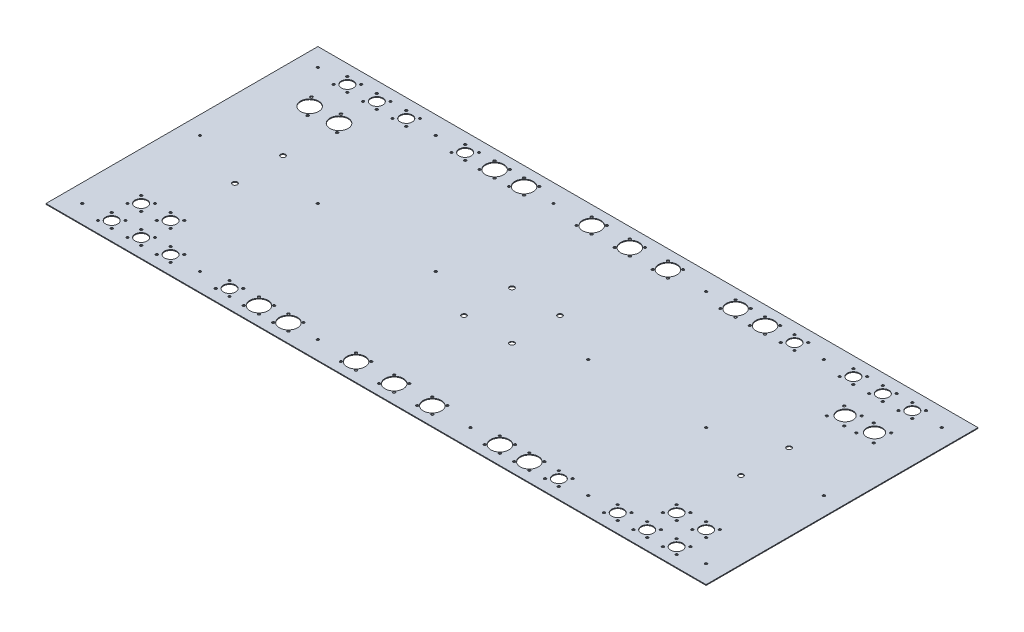
from build123d import *

# Parameters (mm, degrees)
MAIN_PLATE_W        = 874
MAIN_PLATE_H        = 360
BOSS_EXTRUDE1_DEPTH = 1.016
MAIN_HOLES_R        = 1.6
MAIN_HOLES_R_2      = 3.175
CUT_EXTRUDE1_DEPTH  = 473.620389167
FAN_R               = 1.6
FAN_R_2             = 12
CUT_EXTRUDE2_DEPTH  = 474.008271082
NTYPE_R             = 8
NTYPE_R_2           = 1.6
CUT_EXTRUDE3_DEPTH  = 473.620389167
ETHERNET_R          = 12
ETHERNET_R_2        = 1.755
CUT_EXTRUDE6_DEPTH  = 10
POWER_R             = 10.4521
POWER_R_2           = 1.5875
CUT_EXTRUDE7_DEPTH  = 10


with BuildPart() as part:
    # main_plate → Boss-Extrude1 (new body)
    with BuildSketch(Plane(origin=(0, 0, 0), x_dir=(1, 0, 0), z_dir=(0, 1, 0))):
        Rectangle(MAIN_PLATE_W, MAIN_PLATE_H)
    extrude(amount=BOSS_EXTRUDE1_DEPTH)

    # main_holes → Cut-Extrude1 (cut, through all)
    with BuildSketch(Plane(origin=(0, 1.016, 0), x_dir=(1, 0, 0), z_dir=(0, 1, 0))):
        with Locations((-413, 156)):
            Circle(MAIN_HOLES_R)
        with Locations((-335, 31.805896398)):
            Circle(MAIN_HOLES_R_2)
        with Locations((-335, -31.805896398)):
            Circle(MAIN_HOLES_R_2)
        with Locations((-257, 156)):
            Circle(MAIN_HOLES_R)
        with Locations((-101, 156)):
            Circle(MAIN_HOLES_R)
        with Locations((-257, 0)):
            Circle(MAIN_HOLES_R)
        with Locations((-101, 0)):
            Circle(MAIN_HOLES_R)
        with Locations((-257, -156)):
            Circle(MAIN_HOLES_R)
        with Locations((-101, -156)):
            Circle(MAIN_HOLES_R)
        with Locations((-413, 0)):
            Circle(MAIN_HOLES_R)
        with Locations((-413, -156)):
            Circle(MAIN_HOLES_R)
        with Locations((-31.75, 31.75)):
            Circle(MAIN_HOLES_R_2)
        with Locations((-31.75, -31.75)):
            Circle(MAIN_HOLES_R_2)
        with Locations((31.75, -31.75)):
            Circle(MAIN_HOLES_R_2)
        with Locations((31.75, 31.75)):
            Circle(MAIN_HOLES_R_2)
        with Locations((413, -156)):
            Circle(MAIN_HOLES_R)
        with Locations((413, 0)):
            Circle(MAIN_HOLES_R)
        with Locations((101, -156)):
            Circle(MAIN_HOLES_R)
        with Locations((257, -156)):
            Circle(MAIN_HOLES_R)
        with Locations((101, 0)):
            Circle(MAIN_HOLES_R)
        with Locations((257, 0)):
            Circle(MAIN_HOLES_R)
        with Locations((101, 156)):
            Circle(MAIN_HOLES_R)
        with Locations((257, 156)):
            Circle(MAIN_HOLES_R)
        with Locations((335, -31.805896398)):
            Circle(MAIN_HOLES_R_2)
        with Locations((335, 31.805896398)):
            Circle(MAIN_HOLES_R_2)
        with Locations((413, 156)):
            Circle(MAIN_HOLES_R)
    extrude(amount=-CUT_EXTRUDE1_DEPTH, mode=Mode.SUBTRACT)

    # fan → Cut-Extrude2 (cut, through all)
    with BuildSketch(Plane(origin=(0, 1.016, 1.016), x_dir=(1, 0, 0), z_dir=(0, 1, 0))):
        with Locations((130, -144.984)):
            Circle(FAN_R)
        with Locations((150, -144.984)):
            Circle(FAN_R)
        with Locations((150, -164.984)):
            Circle(FAN_R)
        with Locations((130, -164.984)):
            Circle(FAN_R)
        with Locations((140, -154.984)):
            Circle(FAN_R_2)
        with Locations((169, -144.984)):
            Circle(FAN_R)
        with Locations((189, -144.984)):
            Circle(FAN_R)
        with Locations((189, -164.984)):
            Circle(FAN_R)
        with Locations((169, -164.984)):
            Circle(FAN_R)
        with Locations((179, -154.984)):
            Circle(FAN_R_2)
        with Locations((-10, -144.984)):
            Circle(FAN_R)
        with Locations((10, -144.984)):
            Circle(FAN_R)
        with Locations((10, -164.984)):
            Circle(FAN_R)
        with Locations((-10, -164.984)):
            Circle(FAN_R)
        with Locations((0, -154.984)):
            Circle(FAN_R_2)
        with Locations((-60.5, -144.984)):
            Circle(FAN_R)
        with Locations((-40.5, -144.984)):
            Circle(FAN_R)
        with Locations((-40.5, -164.984)):
            Circle(FAN_R)
        with Locations((-60.5, -164.984)):
            Circle(FAN_R)
        with Locations((-50.5, -154.984)):
            Circle(FAN_R_2)
        with Locations((40.5, -144.984)):
            Circle(FAN_R)
        with Locations((60.5, -144.984)):
            Circle(FAN_R)
        with Locations((60.5, -164.984)):
            Circle(FAN_R)
        with Locations((40.5, -164.984)):
            Circle(FAN_R)
        with Locations((50.5, -154.984)):
            Circle(FAN_R_2)
        with Locations((-10, 167.016)):
            Circle(FAN_R)
        with Locations((10, 167.016)):
            Circle(FAN_R)
        with Locations((10, 147.016)):
            Circle(FAN_R)
        with Locations((-10, 147.016)):
            Circle(FAN_R)
        with Locations((0, 157.016)):
            Circle(FAN_R_2)
        with Locations((-60.5, 167.016)):
            Circle(FAN_R)
        with Locations((-40.5, 167.016)):
            Circle(FAN_R)
        with Locations((-40.5, 147.016)):
            Circle(FAN_R)
        with Locations((-60.5, 147.016)):
            Circle(FAN_R)
        with Locations((-50.5, 157.016)):
            Circle(FAN_R_2)
        with Locations((40.5, 167.016)):
            Circle(FAN_R)
        with Locations((60.5, 167.016)):
            Circle(FAN_R)
        with Locations((60.5, 147.016)):
            Circle(FAN_R)
        with Locations((40.5, 147.016)):
            Circle(FAN_R)
        with Locations((50.5, 157.016)):
            Circle(FAN_R_2)
        with Locations((-189, -144.984)):
            Circle(FAN_R)
        with Locations((-169, -144.984)):
            Circle(FAN_R)
        with Locations((-169, -164.984)):
            Circle(FAN_R)
        with Locations((-189, -164.984)):
            Circle(FAN_R)
        with Locations((-179, -154.984)):
            Circle(FAN_R_2)
        with Locations((-150, -144.984)):
            Circle(FAN_R)
        with Locations((-130, -144.984)):
            Circle(FAN_R)
        with Locations((-130, -164.984)):
            Circle(FAN_R)
        with Locations((-150, -164.984)):
            Circle(FAN_R)
        with Locations((-140, -154.984)):
            Circle(FAN_R_2)
        with Locations((-189, 167.016)):
            Circle(FAN_R)
        with Locations((-169, 167.016)):
            Circle(FAN_R)
        with Locations((-169, 147.016)):
            Circle(FAN_R)
        with Locations((-189, 147.016)):
            Circle(FAN_R)
        with Locations((-179, 157.016)):
            Circle(FAN_R_2)
        with Locations((-150, 167.016)):
            Circle(FAN_R)
        with Locations((-130, 167.016)):
            Circle(FAN_R)
        with Locations((-130, 147.016)):
            Circle(FAN_R)
        with Locations((-150, 147.016)):
            Circle(FAN_R)
        with Locations((-140, 157.016)):
            Circle(FAN_R_2)
        with Locations((130, 167.016)):
            Circle(FAN_R)
        with Locations((150, 167.016)):
            Circle(FAN_R)
        with Locations((150, 147.016)):
            Circle(FAN_R)
        with Locations((130, 147.016)):
            Circle(FAN_R)
        with Locations((140, 157.016)):
            Circle(FAN_R_2)
        with Locations((169, 167.016)):
            Circle(FAN_R)
        with Locations((189, 167.016)):
            Circle(FAN_R)
        with Locations((189, 147.016)):
            Circle(FAN_R)
        with Locations((169, 147.016)):
            Circle(FAN_R)
        with Locations((179, 157.016)):
            Circle(FAN_R_2)
    extrude(amount=-CUT_EXTRUDE2_DEPTH, mode=Mode.SUBTRACT)

    # ntype → Cut-Extrude3 (cut, through all)
    with BuildSketch(Plane(origin=(0, 1.016, 0), x_dir=(1, 0, 0), z_dir=(0, 1, 0))):
        with Locations((-218, 156)):
            Circle(NTYPE_R)
        with Locations((-227.1, 165.1)):
            Circle(NTYPE_R_2)
        with Locations((-208.9, 165.1)):
            Circle(NTYPE_R_2)
        with Locations((-208.9, 146.9)):
            Circle(NTYPE_R_2)
        with Locations((-227.1, 146.9)):
            Circle(NTYPE_R_2)
        with Locations((218, 156)):
            Circle(NTYPE_R)
        with Locations((208.9, 165.1)):
            Circle(NTYPE_R_2)
        with Locations((227.1, 165.1)):
            Circle(NTYPE_R_2)
        with Locations((227.1, 146.9)):
            Circle(NTYPE_R_2)
        with Locations((208.9, 146.9)):
            Circle(NTYPE_R_2)
        with Locations((-218, -156)):
            Circle(NTYPE_R)
        with Locations((-227.1, -146.9)):
            Circle(NTYPE_R_2)
        with Locations((-208.9, -146.9)):
            Circle(NTYPE_R_2)
        with Locations((-208.9, -165.1)):
            Circle(NTYPE_R_2)
        with Locations((-227.1, -165.1)):
            Circle(NTYPE_R_2)
        with Locations((218, -156)):
            Circle(NTYPE_R)
        with Locations((208.9, -146.9)):
            Circle(NTYPE_R_2)
        with Locations((227.1, -146.9)):
            Circle(NTYPE_R_2)
        with Locations((227.1, -165.1)):
            Circle(NTYPE_R_2)
        with Locations((208.9, -165.1)):
            Circle(NTYPE_R_2)
        with Locations((-374, 156)):
            Circle(NTYPE_R)
        with Locations((-383.1, 165.1)):
            Circle(NTYPE_R_2)
        with Locations((-364.9, 165.1)):
            Circle(NTYPE_R_2)
        with Locations((-364.9, 146.9)):
            Circle(NTYPE_R_2)
        with Locations((-383.1, 146.9)):
            Circle(NTYPE_R_2)
        with Locations((-296, 156)):
            Circle(NTYPE_R)
        with Locations((-305.1, 165.1)):
            Circle(NTYPE_R_2)
        with Locations((-286.9, 165.1)):
            Circle(NTYPE_R_2)
        with Locations((-286.9, 146.9)):
            Circle(NTYPE_R_2)
        with Locations((-305.1, 146.9)):
            Circle(NTYPE_R_2)
        with Locations((-335, 156)):
            Circle(NTYPE_R)
        with Locations((-344.1, 165.1)):
            Circle(NTYPE_R_2)
        with Locations((-325.9, 165.1)):
            Circle(NTYPE_R_2)
        with Locations((-325.9, 146.9)):
            Circle(NTYPE_R_2)
        with Locations((-344.1, 146.9)):
            Circle(NTYPE_R_2)
        with Locations((296, -156)):
            Circle(NTYPE_R)
        with Locations((286.9, -146.9)):
            Circle(NTYPE_R_2)
        with Locations((305.1, -146.9)):
            Circle(NTYPE_R_2)
        with Locations((305.1, -165.1)):
            Circle(NTYPE_R_2)
        with Locations((286.9, -165.1)):
            Circle(NTYPE_R_2)
        with Locations((374, -156)):
            Circle(NTYPE_R)
        with Locations((364.9, -146.9)):
            Circle(NTYPE_R_2)
        with Locations((383.1, -146.9)):
            Circle(NTYPE_R_2)
        with Locations((383.1, -165.1)):
            Circle(NTYPE_R_2)
        with Locations((364.9, -165.1)):
            Circle(NTYPE_R_2)
        with Locations((335, -156)):
            Circle(NTYPE_R)
        with Locations((325.9, -146.9)):
            Circle(NTYPE_R_2)
        with Locations((344.1, -146.9)):
            Circle(NTYPE_R_2)
        with Locations((344.1, -165.1)):
            Circle(NTYPE_R_2)
        with Locations((325.9, -165.1)):
            Circle(NTYPE_R_2)
        with Locations((296, 156)):
            Circle(NTYPE_R)
        with Locations((286.9, 165.1)):
            Circle(NTYPE_R_2)
        with Locations((305.1, 165.1)):
            Circle(NTYPE_R_2)
        with Locations((305.1, 146.9)):
            Circle(NTYPE_R_2)
        with Locations((286.9, 146.9)):
            Circle(NTYPE_R_2)
        with Locations((374, 156)):
            Circle(NTYPE_R)
        with Locations((364.9, 165.1)):
            Circle(NTYPE_R_2)
        with Locations((383.1, 165.1)):
            Circle(NTYPE_R_2)
        with Locations((383.1, 146.9)):
            Circle(NTYPE_R_2)
        with Locations((364.9, 146.9)):
            Circle(NTYPE_R_2)
        with Locations((335, 156)):
            Circle(NTYPE_R)
        with Locations((325.9, 165.1)):
            Circle(NTYPE_R_2)
        with Locations((344.1, 165.1)):
            Circle(NTYPE_R_2)
        with Locations((344.1, 146.9)):
            Circle(NTYPE_R_2)
        with Locations((325.9, 146.9)):
            Circle(NTYPE_R_2)
        with Locations((-374, -156)):
            Circle(NTYPE_R)
        with Locations((-383.1, -146.9)):
            Circle(NTYPE_R_2)
        with Locations((-364.9, -146.9)):
            Circle(NTYPE_R_2)
        with Locations((-364.9, -165.1)):
            Circle(NTYPE_R_2)
        with Locations((-383.1, -165.1)):
            Circle(NTYPE_R_2)
        with Locations((-296, -156)):
            Circle(NTYPE_R)
        with Locations((-305.1, -146.9)):
            Circle(NTYPE_R_2)
        with Locations((-286.9, -146.9)):
            Circle(NTYPE_R_2)
        with Locations((-286.9, -165.1)):
            Circle(NTYPE_R_2)
        with Locations((-305.1, -165.1)):
            Circle(NTYPE_R_2)
        with Locations((-335, -156)):
            Circle(NTYPE_R)
        with Locations((-344.1, -146.9)):
            Circle(NTYPE_R_2)
        with Locations((-325.9, -146.9)):
            Circle(NTYPE_R_2)
        with Locations((-325.9, -165.1)):
            Circle(NTYPE_R_2)
        with Locations((-344.1, -165.1)):
            Circle(NTYPE_R_2)
        with Locations((-335, -117)):
            Circle(NTYPE_R)
        with Locations((-344.1, -107.9)):
            Circle(NTYPE_R_2)
        with Locations((-325.9, -107.9)):
            Circle(NTYPE_R_2)
        with Locations((-325.9, -126.1)):
            Circle(NTYPE_R_2)
        with Locations((-344.1, -126.1)):
            Circle(NTYPE_R_2)
        with Locations((-374, -117)):
            Circle(NTYPE_R)
        with Locations((-383.1, -107.9)):
            Circle(NTYPE_R_2)
        with Locations((-364.9, -107.9)):
            Circle(NTYPE_R_2)
        with Locations((-364.9, -126.1)):
            Circle(NTYPE_R_2)
        with Locations((-383.1, -126.1)):
            Circle(NTYPE_R_2)
        with Locations((374, -117)):
            Circle(NTYPE_R)
        with Locations((364.9, -107.9)):
            Circle(NTYPE_R_2)
        with Locations((383.1, -107.9)):
            Circle(NTYPE_R_2)
        with Locations((383.1, -126.1)):
            Circle(NTYPE_R_2)
        with Locations((364.9, -126.1)):
            Circle(NTYPE_R_2)
        with Locations((335, -117)):
            Circle(NTYPE_R)
        with Locations((325.9, -107.9)):
            Circle(NTYPE_R_2)
        with Locations((344.1, -107.9)):
            Circle(NTYPE_R_2)
        with Locations((344.1, -126.1)):
            Circle(NTYPE_R_2)
        with Locations((325.9, -126.1)):
            Circle(NTYPE_R_2)
    extrude(amount=-CUT_EXTRUDE3_DEPTH, mode=Mode.SUBTRACT)

    # ethernet → Cut-Extrude6 (cut)
    with BuildSketch(Plane(origin=(0, 1.016, 0), x_dir=(1, 0, 0), z_dir=(0, 1, 0))):
        with Locations((-374, 106)):
            Circle(ETHERNET_R)
        with Locations((-383.5, 118)):
            Circle(ETHERNET_R_2)
        with Locations((-364.5, 94)):
            Circle(ETHERNET_R_2)
        with Locations((-335, 106)):
            Circle(ETHERNET_R)
        with Locations((-344.5, 118)):
            Circle(ETHERNET_R_2)
        with Locations((-325.5, 94)):
            Circle(ETHERNET_R_2)
    extrude(amount=-CUT_EXTRUDE6_DEPTH, mode=Mode.SUBTRACT)

    # power → Cut-Extrude7 (cut)
    with BuildSketch(Plane(origin=(0, 1.016, 0), x_dir=(1, 0, 0), z_dir=(0, 1, 0))):
        with Locations((374, 106)):
            Circle(POWER_R)
        with Locations((362.4938, 116.4521)):
            Circle(POWER_R_2)
        with Locations((385.5062, 116.4521)):
            Circle(POWER_R_2)
        with Locations((385.5062, 93.4397)):
            Circle(POWER_R_2)
        with Locations((362.4938, 93.4397)):
            Circle(POWER_R_2)
        with Locations((335, 106)):
            Circle(POWER_R)
        with Locations((323.4938, 116.4521)):
            Circle(POWER_R_2)
        with Locations((346.5062, 116.4521)):
            Circle(POWER_R_2)
        with Locations((346.5062, 93.4397)):
            Circle(POWER_R_2)
        with Locations((323.4938, 93.4397)):
            Circle(POWER_R_2)
    extrude(amount=-CUT_EXTRUDE7_DEPTH, mode=Mode.SUBTRACT)


solid = part.part
